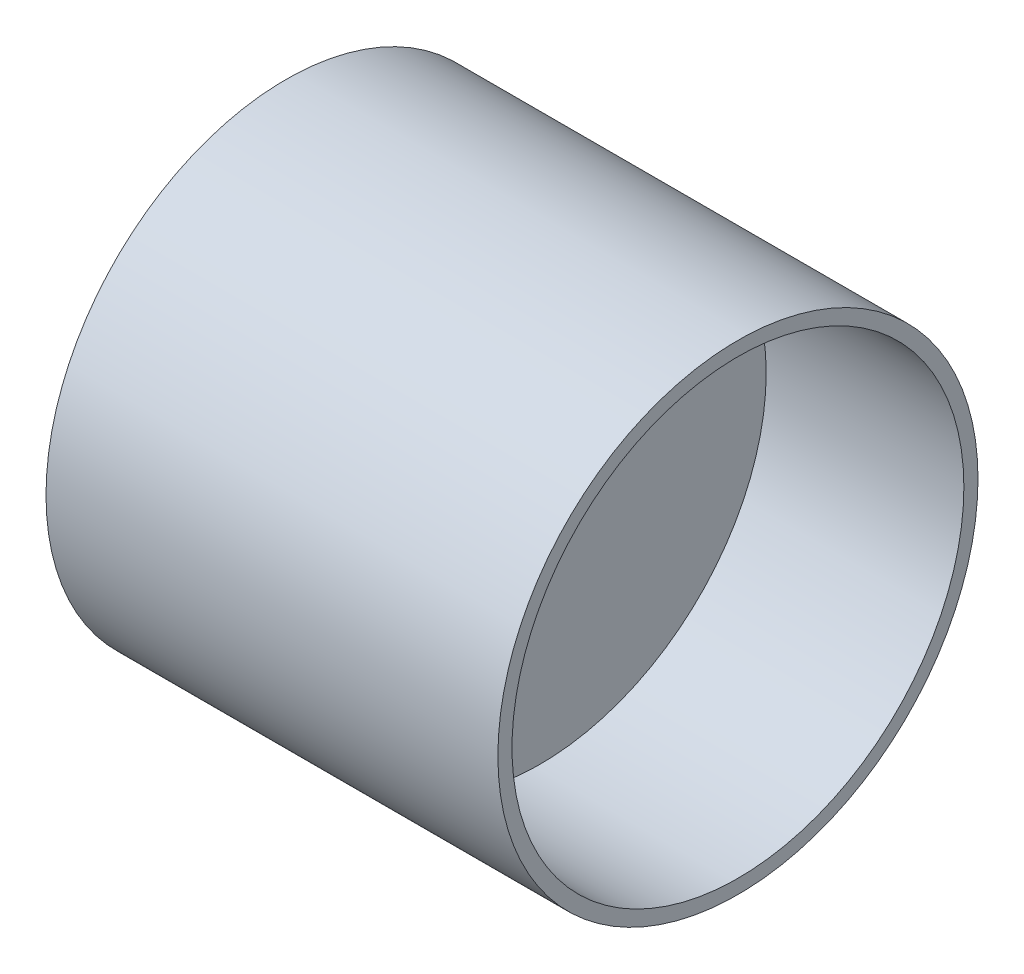
from build123d import *

# Parameters (mm, degrees)
SKETCH1_R           = 42.5
BOSS_EXTRUDE1_DEPTH = 50
SKETCH6_R           = 40
CUT_EXTRUDE6_DEPTH  = 35
CUT_EXTRUDE12_START = -20
SKETCH9_R           = 42.5
CUT_EXTRUDE12_DEPTH = 20


with BuildPart() as part:
    # Sketch1 → Boss-Extrude1 (new, symmetric)
    with BuildSketch(Plane(origin=(0, 0, 0), x_dir=(0, 0, -1), z_dir=(1, 0, 0))):
        Circle(SKETCH1_R)
    extrude(amount=BOSS_EXTRUDE1_DEPTH, both=True)

    # Sketch6 → Cut-Extrude6 (cut)
    with BuildSketch(Plane(origin=(50, 0, 0), x_dir=(0, 0, -1), z_dir=(1, 0, 0))):
        Circle(SKETCH6_R)
    extrude(amount=-CUT_EXTRUDE6_DEPTH, mode=Mode.SUBTRACT)

    # Sketch9 → Cut-Extrude12 (cut)
    with BuildSketch(Plane.ZY.offset(50).offset(CUT_EXTRUDE12_START)):
        Circle(SKETCH9_R)
    extrude(amount=CUT_EXTRUDE12_DEPTH, mode=Mode.SUBTRACT)


solid = part.part
